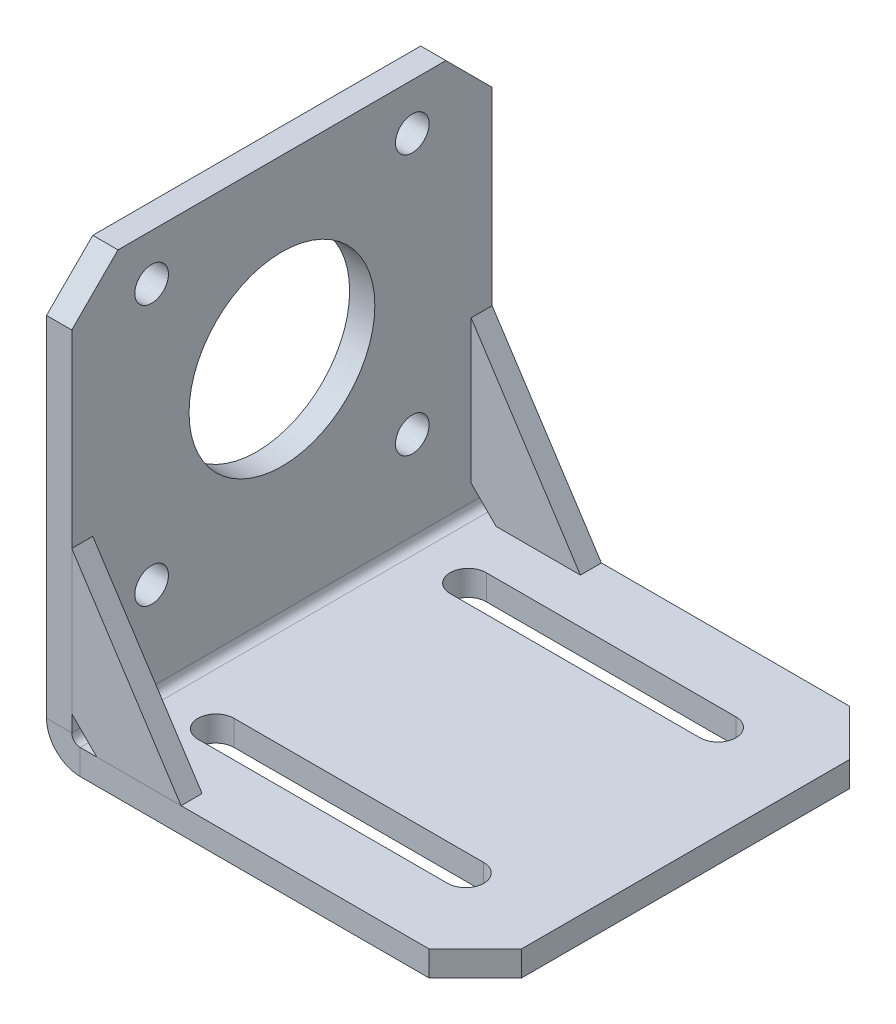
from build123d import *

# Parameters (mm, degrees)
BASE_FLANGE1_DEPTH  = 25
SKETCH7_R           = 11.05
SKETCH7_R_2         = 2
CUT_EXTRUDE1_DEPTH  = 77.334788924
CUT_EXTRUDE2_DEPTH  = 77.334788924
CHAMFER2_SIZE       = 5.5
BOSS_EXTRUDE2_DEPTH = 2.5
LPATTERN1_COUNT     = 2
LPATTERN1_PITCH     = 47.5


# Sheet-metal steps are written as plain solids
with BuildPart() as part:
    # Sketch2 → Base-Flange1 (new, symmetric)
    with BuildSketch(Plane.XY):
        with BuildLine():
            Line((51, 0), (4, 0))
            ThreePointArc((4, 0), (1.171572875, 1.171572875), (0, 4))
            Line((0, 4), (0, 51))
            Line((0, 51), (3, 51))
            Line((3, 51), (3, 4))
            ThreePointArc((3, 4), (3.292893219, 3.292893219), (4, 3))
            Line((4, 3), (51, 3))
            Line((51, 3), (51, 0))
        make_face()
    extrude(amount=BASE_FLANGE1_DEPTH, both=True)

    # Sketch7 → Cut-Extrude1 (cut, through all)
    with BuildSketch(Plane.ZY):
        with Locations((0, 30)):
            Circle(SKETCH7_R)
        with Locations((-15.5, 45.5)):
            Circle(SKETCH7_R_2)
        with Locations((15.5, 45.5)):
            Circle(SKETCH7_R_2)
        with Locations((15.5, 14.5)):
            Circle(SKETCH7_R_2)
        with Locations((-15.5, 14.5)):
            Circle(SKETCH7_R_2)
    extrude(amount=-CUT_EXTRUDE1_DEPTH, mode=Mode.SUBTRACT)

    # Sketch8 → Cut-Extrude2 (cut, through all)
    with BuildSketch(Plane.XZ):
        with BuildLine():
            Line((39.85, -17.15), (10.15, -17.15))
            ThreePointArc((10.15, -17.15), (8, -15), (10.15, -12.85))
            Line((10.15, -12.85), (39.85, -12.85))
            ThreePointArc((39.85, -12.85), (42, -15), (39.85, -17.15))
        make_face()
        with BuildLine():
            Line((39.85, 12.85), (10.15, 12.85))
            ThreePointArc((10.15, 12.85), (8, 15), (10.15, 17.15))
            Line((10.15, 17.15), (39.85, 17.15))
            ThreePointArc((39.85, 17.15), (42, 15), (39.85, 12.85))
        make_face()
    extrude(amount=-CUT_EXTRUDE2_DEPTH, mode=Mode.SUBTRACT)

    # Chamfer2
    chamfer2_edges = [part.edges().sort_by_distance(p)[0] for p in [
        (1.5, 51, 25),
        (51, 1.5, 25),
        (1.5, 51, -25),
        (51, 1.5, -25),
    ]]
    chamfer(chamfer2_edges, length=CHAMFER2_SIZE)


with BuildPart() as body_2:
    # Sketch9 → Boss-Extrude2 (new body)
    with BuildSketch(Plane.XY.offset(25)):
        Polygon((3, 23), (16, 3), (5.976752293, 3), (3, 5.976752293), align=None)
    boss_extrude2 = extrude(amount=-BOSS_EXTRUDE2_DEPTH)


with BuildPart() as lpattern1_1:
    # LPattern1: Boss-Extrude2 ×2
    with Locations(*[(0, 0, -i * LPATTERN1_PITCH) for i in range(1, LPATTERN1_COUNT)]):
        add(boss_extrude2)


solid = Compound([part.part, body_2.part, lpattern1_1.part])
